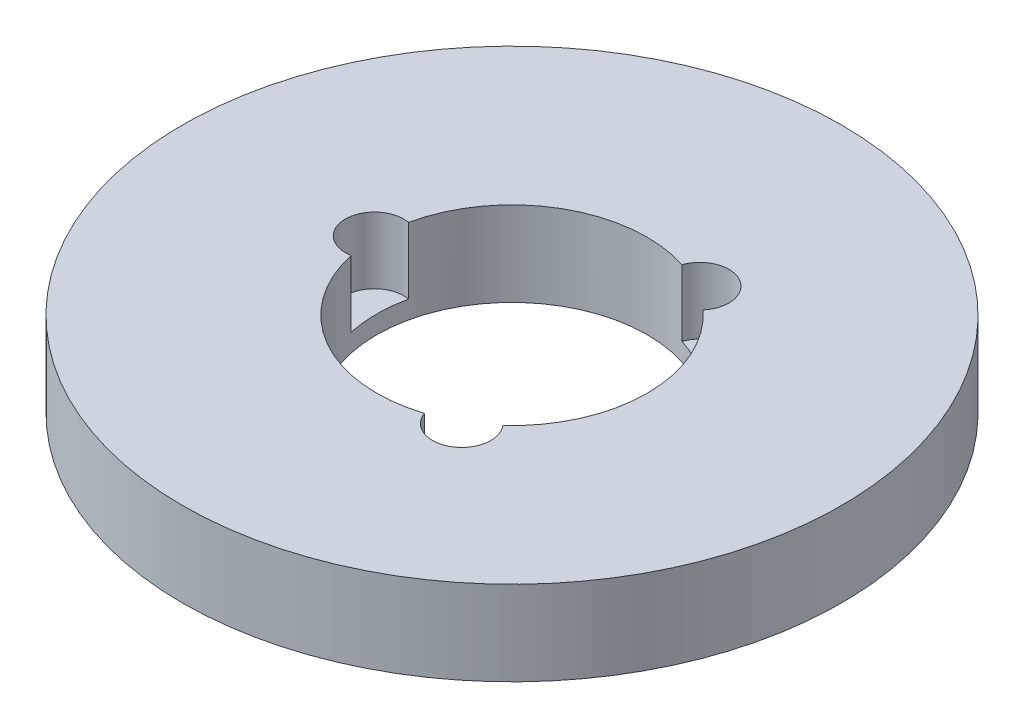
from build123d import *

# Parameters (mm, degrees)
SKETCH1_R           = 97.5
BOSS_EXTRUDE1_DEPTH = 25
SKETCH2_R           = 40
CUT_EXTRUDE1_DEPTH  = 141.133864572
SKETCH3_R           = 8.636377425
CUT_EXTRUDE2_DEPTH  = 19.656917301
CIRPATTERN1_COUNT   = 3


with BuildPart() as part:
    # Sketch1 → Boss-Extrude1 (new body)
    with BuildSketch(Plane(origin=(0, 0, 0), x_dir=(1, 0, 0), z_dir=(0, 1, 0))):
        Circle(SKETCH1_R)
    extrude(amount=BOSS_EXTRUDE1_DEPTH)

    # Sketch2 → Cut-Extrude1 (cut, through all)
    with BuildSketch(Plane(origin=(0, 0, 0), x_dir=(1, 0, 0), z_dir=(0, 1, 0))):
        Circle(SKETCH2_R)
    extrude(amount=CUT_EXTRUDE1_DEPTH, mode=Mode.SUBTRACT)

    # Sketch3 → Cut-Extrude2 (cut)
    with BuildSketch(Plane(origin=(0, 25, 0), x_dir=(1, 0, 0), z_dir=(0, 1, 0))):
        with Locations((-40.667354563, 0)):
            Circle(SKETCH3_R)
    cut_extrude2 = extrude(amount=-CUT_EXTRUDE2_DEPTH, mode=Mode.SUBTRACT)

    # CirPattern1: Cut-Extrude2 ×3 about axis
    cirpattern1_axis = Axis((0, 0, 0), (0, 1, 0))
    for i in range(1, CIRPATTERN1_COUNT):
        add(cut_extrude2.rotate(cirpattern1_axis, i * 360 / CIRPATTERN1_COUNT), mode=Mode.SUBTRACT)


solid = part.part
